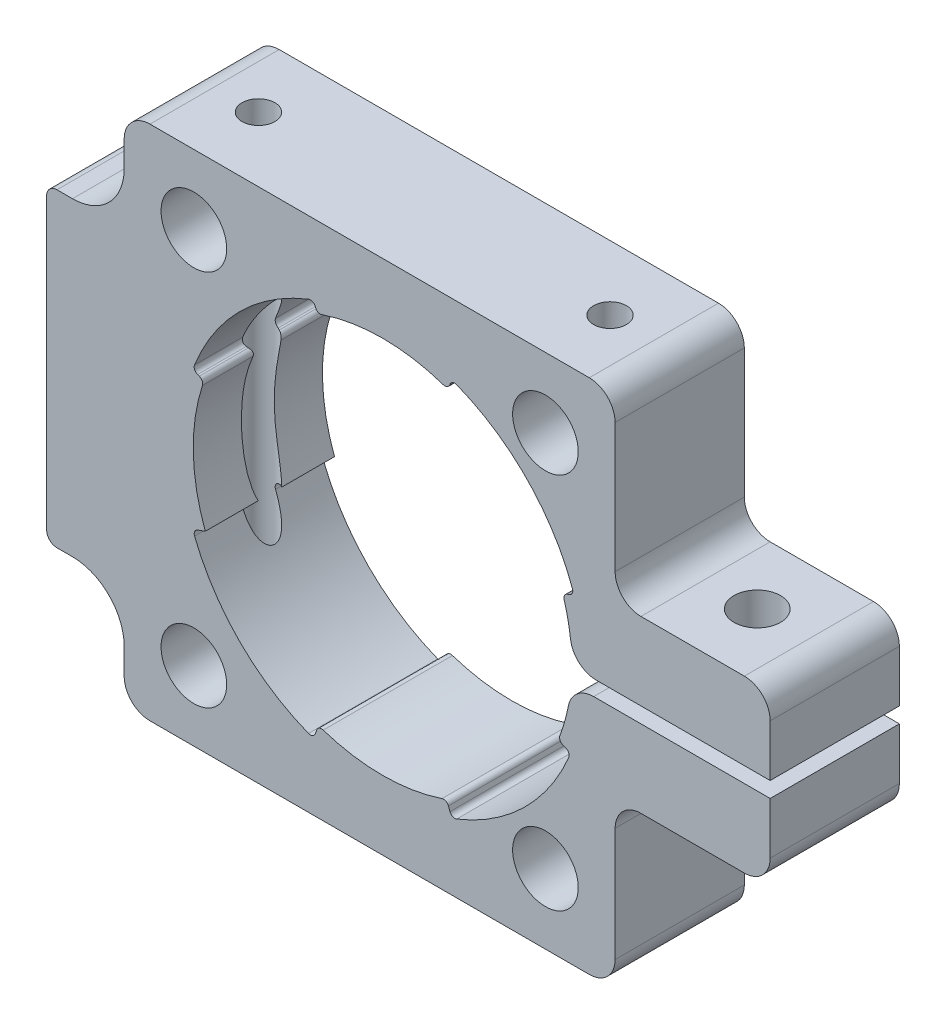
from build123d import *

# Parameters (mm, degrees)
SKETCH1_R                   = 6.35
BOSS_EXTRUDE1_DEPTH         = 25
CUT_EXTRUDE2_REACH          = 106.273
SKETCH3_R                   = 5
M10X1_0_TAPPED_HOLE1_D      = 9
F_1_4_0_25_DIAMETER_HOLE1_D = 6.35
SKETCH15_W                  = 25
SKETCH15_H                  = 60
SKETCH15_R                  = 2.5
BOSS_EXTRUDE2_DEPTH         = 15
FILLET1_R                   = 10
FILLET2_R                   = 2
CUT_EXTRUDE4_DEPTH          = 94.743165708
FILLET3_R                   = 1
FILLET4_R                   = 5


with BuildPart() as part:
    # Sketch1 → Boss-Extrude1 (new body)
    with BuildSketch(Plane.XY):
        with BuildLine():
            Line((36.624934474, 0.38867669), (74.991748635, 0.38867669))
            Line((74.991748635, 0.38867669), (74.991748635, 10.38867669))
            ThreePointArc((74.991748635, 10.38867669), (73.527282541, 13.924210596), (69.991748635, 15.38867669))
            Line((69.991748635, 15.38867669), (49.991748635, 15.38867669))
            ThreePointArc((49.991748635, 15.38867669), (46.456214729, 16.853142784), (44.991748635, 20.38867669))
            Line((44.991748635, 20.38867669), (44.991748635, 45.38867669))
            ThreePointArc((44.991748635, 45.38867669), (43.527282541, 48.924210596), (39.991748635, 50.38867669))
            Line((39.991748635, 50.38867669), (-45.008251365, 50.38867669))
            ThreePointArc((-45.008251365, 50.38867669), (-48.543785271, 48.924210596), (-50.008251365, 45.38867669))
            Line((-50.008251365, 45.38867669), (-50.008251365, -44.61132331))
            ThreePointArc((-50.008251365, -44.61132331), (-48.543785271, -48.146857216), (-45.008251365, -49.61132331))
            Line((-45.008251365, -49.61132331), (39.991748635, -49.61132331))
            ThreePointArc((39.991748635, -49.61132331), (43.527282541, -48.146857216), (44.991748635, -44.61132331))
            Line((44.991748635, -44.61132331), (44.991748635, -22.61132331))
            ThreePointArc((44.991748635, -22.61132331), (46.456214729, -19.075789404), (49.991748635, -17.61132331))
            Line((49.991748635, -17.61132331), (69.991748635, -17.61132331))
            ThreePointArc((69.991748635, -17.61132331), (73.527282541, -16.146857216), (74.991748635, -12.61132331))
            Line((74.991748635, -12.61132331), (74.991748635, -2.61132331))
            Line((74.991748635, -2.61132331), (36.501888387, -2.61132331))
            ThreePointArc((36.501888387, -2.61132331), (-36.610662756, 1.889937855), (36.624934474, 0.38867669))
        make_face()
        with Locations((-36.522969991, 36.903395316)):
            Circle(SKETCH1_R, mode=Mode.SUBTRACT)
        with Locations((31.506467261, 36.903395316)):
            Circle(SKETCH1_R, mode=Mode.SUBTRACT)
        with Locations((31.506467261, -36.126041936)):
            Circle(SKETCH1_R, mode=Mode.SUBTRACT)
        with Locations((-36.522969991, -36.126041936)):
            Circle(SKETCH1_R, mode=Mode.SUBTRACT)
    extrude(amount=-BOSS_EXTRUDE1_DEPTH)

    # Sketch3 → Cut-Extrude2 (cut, up to next)
    with BuildSketch(Plane.XZ.offset(17.61132331), mode=Mode.PRIVATE) as cut_extrude2_sk1:
        with Locations((59.991748635, -12.5)):
            Circle(SKETCH3_R)
    cut_extrude2_tool1 = extrude(cut_extrude2_sk1.sketch, amount=-CUT_EXTRUDE2_REACH, mode=Mode.PRIVATE) & part.part
    add(cut_extrude2_tool1.solids().sort_by_distance((59.991749, -17.611323, -12.5))[0], mode=Mode.SUBTRACT)

    # M10x1.0 Tapped Hole1 (through all)
    with Locations(Plane(origin=(0, 15.38867669, 0), x_dir=(1, 0, 0), z_dir=(0, 1, 0))):
        with Locations((59.991748635, 12.5)):
            Hole(M10X1_0_TAPPED_HOLE1_D / 2)

    # 1/4 (0.25) Diameter Hole1 (through all)
    with Locations(Plane(origin=(0, 50.38867669, 0), x_dir=(1, 0, 0), z_dir=(0, 1, 0))):
        with Locations((31.506467261, 12.5), (-36.522969991, 12.5)):
            Hole(F_1_4_0_25_DIAMETER_HOLE1_D / 2)

    # Sketch15 → Boss-Extrude2 (add)
    with BuildSketch(Plane.ZY.offset(50.008251365)):
        with Locations((-12.5, 0.38867669)):
            Rectangle(SKETCH15_W, SKETCH15_H)
        with Locations((-12.5, 0)):
            Circle(SKETCH15_R, mode=Mode.SUBTRACT)
        with Locations((-12.5, 20)):
            Circle(SKETCH15_R, mode=Mode.SUBTRACT)
        with Locations((-12.5, -20)):
            Circle(SKETCH15_R, mode=Mode.SUBTRACT)
    extrude(amount=BOSS_EXTRUDE2_DEPTH)

    # Fillet1
    fillet1_edges = [part.edges().sort_by_distance(p)[0] for p in [
        (-50.008251365, -29.61132331, -12.5),
        (-50.008251365, 30.38867669, -12.5),
    ]]
    fillet(fillet1_edges, radius=FILLET1_R)

    # Fillet2
    fillet2_edges = [part.edges().sort_by_distance(p)[0] for p in [
        (-65.008251365, -29.61132331, -12.5),
        (-65.008251365, 30.38867669, -12.5),
    ]]
    fillet(fillet2_edges, radius=FILLET2_R)

    # Sketch16 → Cut-Extrude4 (cut, through all)
    with BuildSketch(Plane(origin=(0, 0, -25), x_dir=(-1, 0, 0), z_dir=(0, 0, -1))):
        with BuildLine():
            Line((-12.653148126, 34.76423876), (-13.029755281, 35.798958416))
            ThreePointArc((-13.029755281, 35.798958416), (-13.558757859, 36.368713294), (-14.336007926, 36.387332677))
            ThreePointArc((-14.336007926, 36.387332677), (-28.002351395, 27.302516716), (-36.738442531, 13.410665273))
            ThreePointArc((-36.738442531, 13.410665273), (-36.70016142, 12.634135232), (-36.117202994, 12.119719231))
            Line((-36.117202994, 12.119719231), (-34.837983513, 11.690456175))
            ThreePointArc((-34.837983513, 11.690456175), (-26.39901452, 25.778568639), (-12.653148126, 34.76423876))
        make_face()
        with BuildLine():
            Line((12.655097825, 34.769595516), (13.029755281, 35.798958416))
            ThreePointArc((13.029755281, 35.798958416), (13.558757859, 36.368713294), (14.336007926, 36.387332677))
            ThreePointArc((14.336007926, 36.387332677), (27.654647915, 27.654647915), (36.387332677, 14.336007926))
            ThreePointArc((36.387332677, 14.336007926), (36.368713294, 13.558757859), (35.798958416, 13.029755281))
            Line((35.798958416, 13.029755281), (34.554454204, 12.576792792))
            ThreePointArc((34.554454204, 12.576792792), (26.083643955, 26.119285038), (12.655097825, 34.769595516))
        make_face()
        with BuildLine():
            Line((34.304564761, -12.485840472), (35.798958416, -13.029755281))
            ThreePointArc((35.798958416, -13.029755281), (36.368713294, -13.558757859), (36.387332677, -14.336007926))
            ThreePointArc((36.387332677, -14.336007926), (27.654647915, -27.654647915), (14.336007926, -36.387332677))
            ThreePointArc((14.336007926, -36.387332677), (13.558757859, -36.368713294), (13.029755281, -35.798958416))
            Line((13.029755281, -35.798958416), (12.405242018, -34.083122327))
            ThreePointArc((12.405242018, -34.083122327), (25.731330625, -25.69414329), (34.304564761, -12.485840472))
        make_face()
        with BuildLine():
            Line((-35.457788009, -13.931447012), (-33.95479535, -13.340917716))
            ThreePointArc((-33.95479535, -13.340917716), (-25.391686874, -26.008926273), (-12.403330812, -34.077871332))
            Line((-12.403330812, -34.077871332), (-13.029755281, -35.798958416))
            ThreePointArc((-13.029755281, -35.798958416), (-13.558757859, -36.368713294), (-14.336007926, -36.387332677))
            ThreePointArc((-14.336007926, -36.387332677), (-27.302516716, -28.002351395), (-36.012920198, -15.25216973))
            ThreePointArc((-36.012920198, -15.25216973), (-36.013974464, -14.474697392), (-35.457788009, -13.931447012))
        make_face()
    extrude(amount=-CUT_EXTRUDE4_DEPTH, mode=Mode.SUBTRACT)

    # Fillet3
    # the kernel refuses this fillet: 1 mm, written as the material it takes off along each edge
    with BuildSketch(Plane(origin=(12.653148126, 34.76423876, -27.47614546), x_dir=(-0.9428985869264866, 0.3330799525219653, 0), z_dir=(0, 0, 1))) as fillet3_piece_1:
        with BuildLine():
            CenterArc((0.990547985, -0.999911048), FILLET3_R, 90.764220744, 88.691602328)
            Line((-0.009406913, -0.990413512), (0, 0))
            ThreePointArc((0, 0), (0.488605106, -0.003258597), (0.977210212, 0))
        make_face()
    extrude(amount=29.952290919, mode=Mode.SUBTRACT)
    with BuildSketch(Plane(origin=(34.837983513, 11.690456175, -27.442235883), x_dir=(0.9480462739352389, 0.3181324605844397, 0), z_dir=(0, 0, 1))) as fillet3_piece_2:
        with BuildLine():
            CenterArc((0.976894353, -1), FILLET3_R, 90, 87.912052365)
            ThreePointArc((-0.022441727, -0.963566504), (-0.008051768, -0.481857061), (0, 0))
            Line((0, 0), (0.976894353, 0))
        make_face()
    extrude(amount=29.884471766, mode=Mode.SUBTRACT)
    with BuildSketch(Plane(origin=(-34.554454204, 12.576792792, -12.451709888), x_dir=(-0.3202695803526554, -0.9473264463218231, 0), z_dir=(0, 0, 1))) as fillet3_piece_3:
        with BuildLine():
            CenterArc((0.977211857, -0.999913427), FILLET3_R, 90.753931148, 87.925297592)
            Line((-0.022522462, -0.976863661), (0, 0))
            ThreePointArc((0, 0), (0.482026828, -0.00317144), (0.964053655, 0))
        make_face()
    extrude(amount=14.89451805, mode=Mode.SUBTRACT)
    with BuildSketch(Plane(origin=(-34.554454204, 12.576792792, -27.442808162), x_dir=(-0.3202695803526554, -0.9473264463218231, 0), z_dir=(0, 0, 1))) as fillet3_piece_4:
        with BuildLine():
            CenterArc((0.977211857, -0.999913427), FILLET3_R, 90.753931148, 87.925297592)
            Line((-0.022522462, -0.976863661), (0, 0))
            ThreePointArc((0, 0), (0.482026828, -0.00317144), (0.964053655, 0))
        make_face()
    extrude(amount=14.894518057, mode=Mode.SUBTRACT)
    with BuildSketch(Plane(origin=(-12.655097825, 34.769595516, -27.475111309), x_dir=(-0.3420201433256673, 0.9396926207859089, 0), z_dir=(0, 0, 1))) as fillet3_piece_5:
        with BuildLine():
            CenterArc((0.990044524, -1), FILLET3_R, 90, 88.667986207)
            ThreePointArc((-0.009685253, -0.976754068), (-0.001586911, -0.488409317), (0, 0))
            Line((0, 0), (0.990044524, 0))
        make_face()
    extrude(amount=29.950222618, mode=Mode.SUBTRACT)
    with BuildSketch(Plane(origin=(-12.405242018, -34.083122327, -27.45744658), x_dir=(0.9453963018461555, -0.32592304683101625, 0), z_dir=(0, 0, 1))) as fillet3_piece_6:
        with BuildLine():
            CenterArc((0.983067755, -0.999912386), FILLET3_R, 90.75844931, 88.263057565)
            Line((-0.016786421, -0.98283529), (0, 0))
            ThreePointArc((0, 0), (0.484915352, -0.003209565), (0.969830704, 0))
        make_face()
    extrude(amount=29.91489316, mode=Mode.SUBTRACT)
    with BuildSketch(Plane(origin=(33.95479535, -13.340917716, -12.969268223), x_dir=(0.36231352970280106, 0.9320562784479796, 0), z_dir=(0, 0, 1))) as fillet3_piece_7:
        with BuildLine():
            CenterArc((0.996383006, -0.999909997), FILLET3_R, 90.768722808, 89.023644697)
            Line((-0.003610428, -0.996286134), (0, 0))
            ThreePointArc((0, 0), (0.491483332, -0.003297102), (0.982966664, 0))
        make_face()
    extrude(amount=15.459999913, mode=Mode.SUBTRACT)
    with BuildSketch(Plane(origin=(33.95479535, -13.340917716, -27.49073169), x_dir=(0.36231352970280106, 0.9320562784479796, 0), z_dir=(0, 0, 1))) as fillet3_piece_8:
        with BuildLine():
            CenterArc((0.996383006, -0.999909997), FILLET3_R, 90.768722808, 89.023644697)
            Line((-0.003610428, -0.996286134), (0, 0))
            ThreePointArc((0, 0), (0.491483332, -0.003297102), (0.982966664, 0))
        make_face()
    extrude(amount=15.459999898, mode=Mode.SUBTRACT)
    with BuildSketch(Plane(origin=(12.403330812, -34.077871332, -27.458473544), x_dir=(0.34202014332566943, -0.9396926207859081, 0), z_dir=(0, 0, 1))) as fillet3_piece_9:
        with BuildLine():
            CenterArc((0.983389418, -1), FILLET3_R, 90, 88.286678123)
            ThreePointArc((-0.016163518, -0.970101348), (-0.004869956, -0.485104188), (0, 0))
            Line((0, 0), (0.983389418, 0))
        make_face()
    extrude(amount=29.916947088, mode=Mode.SUBTRACT)

    # Fillet4
    fillet4_edges = [part.edges().sort_by_distance(p)[0] for p in [
        (36.501888387, -2.61132331, -12.5),
        (36.624934474, 0.38867669, -12.5),
    ]]
    fillet(fillet4_edges, radius=FILLET4_R)


solid = part.part
